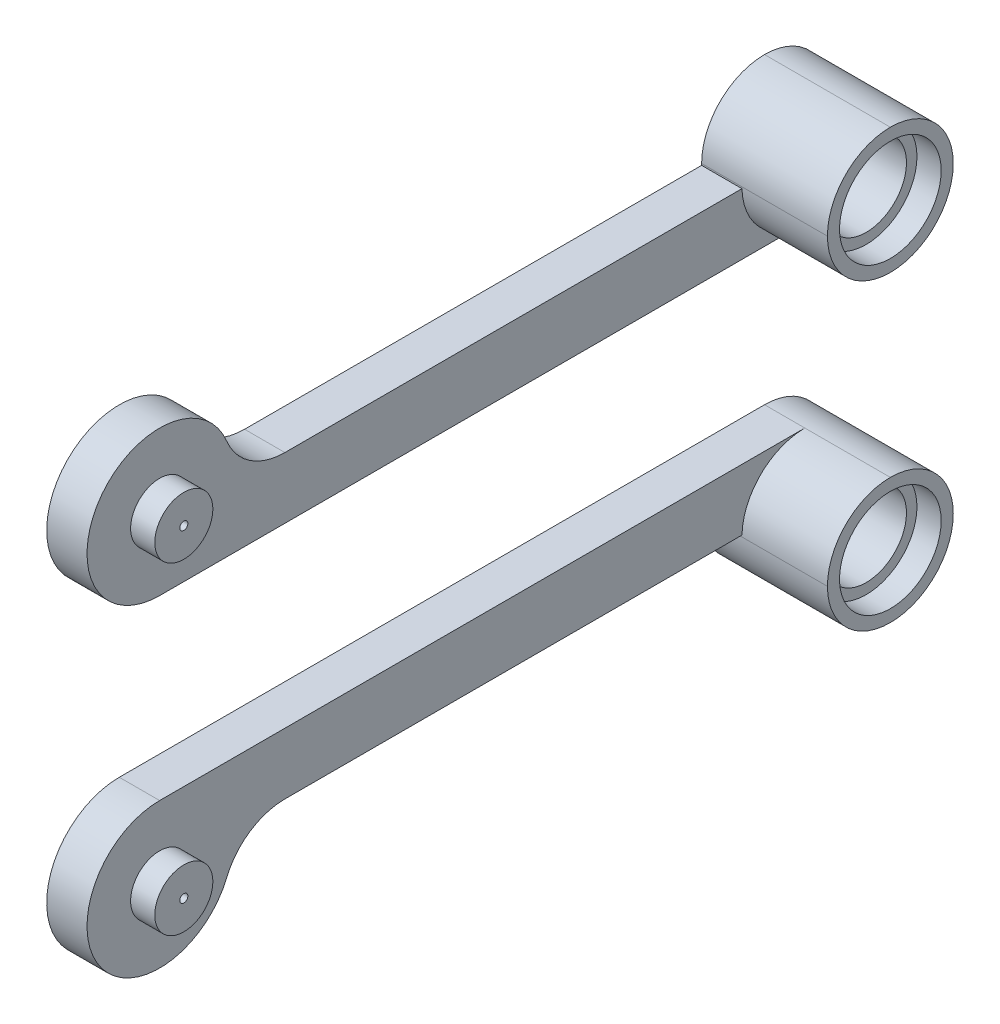
from build123d import *

# Parameters (mm, degrees)
SKETCH_1_R          = 4.5
SKETCH_1_W          = 43.9
SKETCH_1_H          = 7.8
EXTRUDE_1_DEPTH     = 2.5
EXTRUDE_START       = 2.5
SKETCH_1_6_R        = 1.8
SKETCH_1_6_R_2      = 0.25
EXTRUDE_3_DEPTH     = 1.5
SKETCH_1_5_W        = 7.8
SKETCH_1_5_H        = 7.8
EXTRUDE_2_DEPTH     = 7.8
SKETCH_1_7_R        = 2.5
CUT_EXTRUDE_1_DEPTH = 45.814060294
SKETCH_1_8_R        = 3.15
SKETCH_1_8_R_2      = 2.5
CUT_EXTRUDE_2_DEPTH = 1.5
CUT_EXTRUDE_START   = 6.3
SKETCH_1_9_R        = 3.15
SKETCH_1_9_R_2      = 2.5
CUT_EXTRUDE_3_DEPTH = 1.5
CUT_EXTRUDE_4_DEPTH = 45.814060294
FILLET_1_R          = 3.9


with BuildPart() as part:
    # 草图1 → 凸台-拉伸1 (new body)
    with BuildSketch(Plane(origin=(0, 0, 0), x_dir=(0, 0, -1), z_dir=(1, 0, 0))):
        Circle(SKETCH_1_R)
        with Locations((21.95, -0.6)):
            Rectangle(SKETCH_1_W, SKETCH_1_H)
    extrude(amount=EXTRUDE_1_DEPTH)

    # 草图1<6> → 凸台-拉伸3 (add)
    with BuildSketch(Plane(origin=(0, 0, 0), x_dir=(0, 0, -1), z_dir=(1, 0, 0)).offset(EXTRUDE_START)):
        Circle(SKETCH_1_6_R)
        Circle(SKETCH_1_6_R_2, mode=Mode.SUBTRACT)
    extrude(amount=EXTRUDE_3_DEPTH)

    # 草图1<5> → 凸台-拉伸2 (add)
    with BuildSketch(Plane(origin=(0, 0, 0), x_dir=(0, 0, -1), z_dir=(1, 0, 0))):
        with Locations((40, -0.6)):
            Rectangle(SKETCH_1_5_W, SKETCH_1_5_H)
    extrude(amount=EXTRUDE_2_DEPTH)

    # 草图1<7> → 切除-拉伸1 (cut, through all)
    with BuildSketch(Plane(origin=(0, 0, 0), x_dir=(0, 0, -1), z_dir=(1, 0, 0))):
        with Locations((40, -0.6)):
            Circle(SKETCH_1_7_R)
    extrude(amount=CUT_EXTRUDE_1_DEPTH, mode=Mode.SUBTRACT)

    # 草图1<8> → 切除-拉伸2 (cut)
    with BuildSketch(Plane(origin=(0, 0, 0), x_dir=(0, 0, -1), z_dir=(1, 0, 0))):
        with Locations((40, -0.6)):
            Circle(SKETCH_1_8_R)
        with Locations((40, -0.6)):
            Circle(SKETCH_1_8_R_2, mode=Mode.SUBTRACT)
    extrude(amount=CUT_EXTRUDE_2_DEPTH, mode=Mode.SUBTRACT)

    # 草图1<9> → 切除-拉伸3 (cut)
    with BuildSketch(Plane(origin=(0, 0, 0), x_dir=(0, 0, -1), z_dir=(1, 0, 0)).offset(CUT_EXTRUDE_START)):
        with Locations((40, -0.6)):
            Circle(SKETCH_1_9_R)
        with Locations((40, -0.6)):
            Circle(SKETCH_1_9_R_2, mode=Mode.SUBTRACT)
    extrude(amount=CUT_EXTRUDE_3_DEPTH, mode=Mode.SUBTRACT)

    # 草图2 → 切除-拉伸4 (cut, through all)
    with BuildSketch(Plane.ZY):
        Polygon((-4.5, 3.3), (-36.1, 3.3), (-36.1, -0.7), (-4.5, -0.7), (-4.5, 0), align=None)
        with BuildLine():
            Line((-3.059411708, 3.3), (-4.5, 3.3))
            Line((-4.5, 3.3), (-4.5, 0))
            ThreePointArc((-4.5, 0), (-4.124157653, 1.800367645), (-3.059411708, 3.3))
        make_face()
    extrude(amount=-CUT_EXTRUDE_4_DEPTH, mode=Mode.SUBTRACT)

    # 圆角1
    # the kernel refuses this fillet: 3.9 mm, written as the material it adds along each edge
    with BuildSketch(Plane(origin=(0, -0.7, -4.5), x_dir=(0, 0, -1), z_dir=(1, 0, 0))) as fillet_1_piece_1:
        with BuildLine():
            CenterArc((3.266595136, 3.9), FILLET_1_R, 202.392687805, 67.607312195)
            Line((-0.339324035, 2.414285714), (-0.699915952, 2.265714286))
            ThreePointArc((-0.699915952, 2.265714286), (-0.39, 0.7), (-0.39, 0))
            Line((-0.39, 0), (0, -0.39))
            Line((0, -0.39), (3.266595136, -0.39))
            Line((3.266595136, -0.39), (3.266595136, 0))
        make_face()
    extrude(amount=2.5)
    # the kernel refuses this fillet: 3.9 mm, written as the material it takes off along each edge
    with BuildSketch(Plane(origin=(-9.75, -4.5, -43.9), x_dir=(0, 1, 0), z_dir=(1, 0, 0))) as fillet_1_2_piece_1:
        with BuildLine():
            CenterArc((FILLET_1_R, FILLET_1_R), FILLET_1_R, 180, 90)
            Line((0, FILLET_1_R), (0, 0))
            Line((0, 0), (FILLET_1_R, 0))
        make_face()
    extrude(amount=27.3, mode=Mode.SUBTRACT)
    with BuildSketch(Plane(origin=(17.55, 3.3, -43.9), x_dir=(0, 0, 1), z_dir=(-1, 0, 0)), Plane(origin=(17.55, 3.3, -36.1), x_dir=(0, -1, 0), z_dir=(-1, 0, 0))) as fillet_1_2_piece_2:
        with BuildLine():
            CenterArc((FILLET_1_R, -FILLET_1_R), FILLET_1_R, 90, 90)
            Line((0, -FILLET_1_R), (0, 0))
            Line((0, 0), (FILLET_1_R, 0))
        make_face()
    extrude(amount=27.3, mode=Mode.SUBTRACT)
    with BuildSketch(Plane(origin=(-7.25, -4.5, -36.1), x_dir=(0, 1, 0), z_dir=(1, 0, 0))) as fillet_1_2_piece_3_section:
        with BuildLine():
            CenterArc((FILLET_1_R, -FILLET_1_R), FILLET_1_R, 90, 90)
            Line((0, -FILLET_1_R), (0, 0))
            Line((0, 0), (FILLET_1_R, 0))
        make_face()
    fillet_1_2_piece_3 = extrude(amount=24.8, mode=Mode.PRIVATE)
    fillet_1_2_piece_3 = split(fillet_1_2_piece_3, bisect_by=Plane(origin=(1.25, -0.7, -36.100384668), z_dir=(0, 1, 0)), keep=Keep.TOP, mode=Mode.PRIVATE)
    add(fillet_1_2_piece_3, mode=Mode.SUBTRACT)
    with BuildSketch(Plane(origin=(2.5, -4.5, -36.1), x_dir=(0, 1, 0), z_dir=(1, 0, 0))) as fillet_1_2_piece_4:
        with BuildLine():
            CenterArc((FILLET_1_R, -FILLET_1_R), FILLET_1_R, 90, 90)
            Line((0, -FILLET_1_R), (0, 0))
            Line((0, 0), (FILLET_1_R, 0))
        make_face()
    extrude(amount=15.05, mode=Mode.SUBTRACT)


with BuildPart() as body_2:
    # 镜向2: mirrored copy
    add(part.part.mirror(Plane.ZX.offset(-10)))


solid = Compound([part.part, body_2.part])
